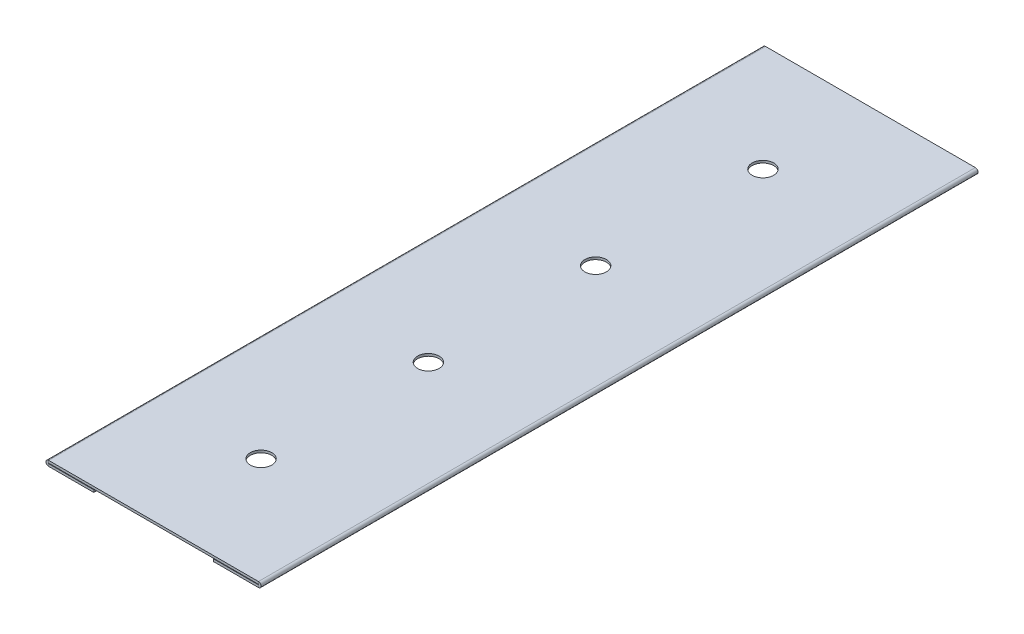
from build123d import *

# Parameters (mm, degrees)
SKETCH1_W           = 45
SKETCH1_H           = 150
BOSS_EXTRUDE1_DEPTH = 0.5
SKETCH2_R           = 2.25
CUT_EXTRUDE1_DEPTH  = 10.5
HEM1_START          = -75
HEM1_DEPTH          = 150
HEM1_2_DEPTH        = 150


# Read off the part's stored shape, not the designer's step: Hem1
with BuildPart() as part:
    # Sketch1 → Boss-Extrude1 (new body)
    with BuildSketch(Plane(origin=(0, 0, 0), x_dir=(1, 0, 0), z_dir=(0, 1, 0))):
        Rectangle(SKETCH1_W, SKETCH1_H)
    extrude(amount=BOSS_EXTRUDE1_DEPTH)

    # Sketch2 → Cut-Extrude1 (cut)
    with BuildSketch(Plane(origin=(0, 0.5, 0), x_dir=(1, 0, 0), z_dir=(0, 1, 0))):
        with Locations(Location((0, 52.5, 0), (0, 0, 270))):
            Circle(SKETCH2_R)
        with Locations(Location((0, 17.5, 0), (0, 0, 270))):
            Circle(SKETCH2_R)
        with Locations(Location((0, -17.5, 0), (0, 0, 270))):
            Circle(SKETCH2_R)
        with Locations(Location((0, -52.5, 0), (0, 0, 270))):
            Circle(SKETCH2_R)
    extrude(amount=-CUT_EXTRUDE1_DEPTH, mode=Mode.SUBTRACT)

    # Hem1 outline → Hem1 (cut)
    with BuildSketch(Plane.XY.offset(HEM1_START)):
        with BuildLine():
            ThreePointArc((21.95, 0.5), (22.320809924, 0.35620192), (22.497722558, 0))
            Line((22.497722558, 0), (22.5, 0))
            Line((22.5, 0), (22.5, 0.5))
            Line((22.5, 0.5), (21.95, 0.5))
        make_face()
        with BuildLine():
            ThreePointArc((-22.497722558, 0), (-22.320809924, 0.35620192), (-21.95, 0.5))
            Line((-21.95, 0.5), (-22.5, 0.5))
            Line((-22.5, 0.5), (-22.5, 0))
            Line((-22.5, 0), (-22.497722558, 0))
        make_face()
    extrude(amount=HEM1_DEPTH, mode=Mode.SUBTRACT)

    # Hem1 2 outline → Hem1 2 (add)
    with BuildSketch(Plane.XY.offset(HEM1_START)):
        with BuildLine():
            Line((12.5, -0.1), (12.5, -0.6))
            Line((12.5, -0.6), (21.95, -0.6))
            ThreePointArc((21.95, -0.6), (22.35620192, -0.420809924), (22.497722558, 0))
            Line((22.497722558, 0), (21.95, 0))
            ThreePointArc((21.95, 0), (22, -0.05), (21.95, -0.1))
            Line((21.95, -0.1), (12.5, -0.1))
        make_face()
        with BuildLine():
            ThreePointArc((-21.95, -0.1), (-22, -0.05), (-21.95, 0))
            Line((-21.95, 0), (-22.497722558, 0))
            ThreePointArc((-22.497722558, 0), (-22.35620192, -0.420809924), (-21.95, -0.6))
            Line((-21.95, -0.6), (-12.5, -0.6))
            Line((-12.5, -0.6), (-12.5, -0.1))
            Line((-12.5, -0.1), (-21.95, -0.1))
        make_face()
    extrude(amount=HEM1_2_DEPTH)


solid = part.part
